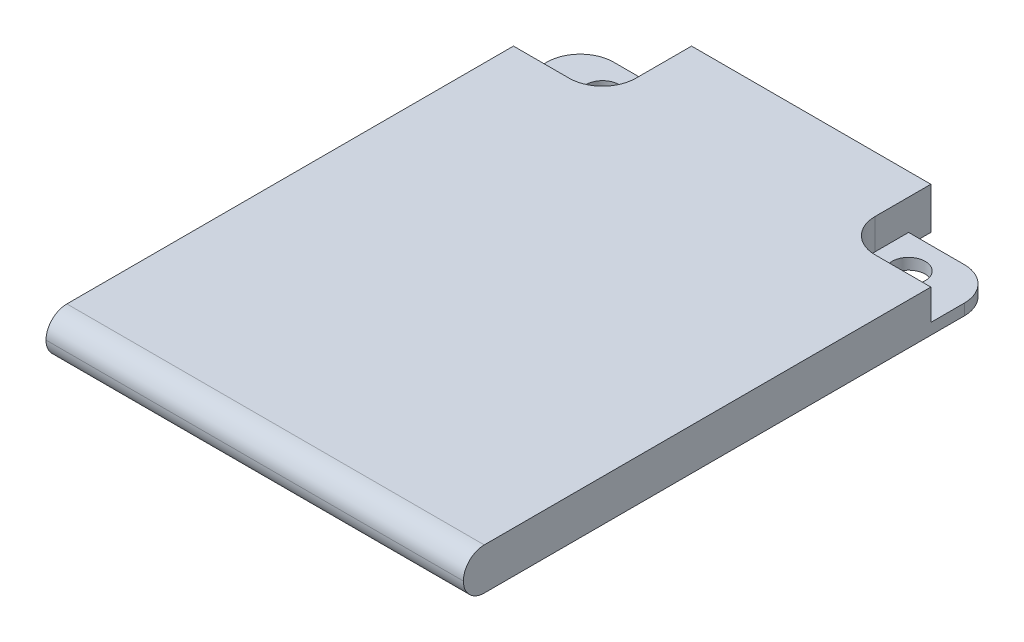
from build123d import *

# Parameters (mm, degrees)
SKETCH1_R           = 1.5
BOSS_EXTRUDE1_DEPTH = 3.75
FILLET1_R           = 1.875
CUT_EXTRUDE1_DEPTH  = 2.75
FILLET2_R           = 3


with BuildPart() as part:
    # Sketch1 → Boss-Extrude1 (new body)
    with BuildSketch(Plane(origin=(0, 0, 0), x_dir=(1, 0, 0), z_dir=(0, 1, 0))):
        Polygon((0, 0), (37.5, 0), (37.5, 48), (29.5, 48), (29.5, 50), (8, 50), (8, 48), (0, 48), align=None)
        with Locations(Location((5, 45, 0), (0, 0, 270))):
            Circle(SKETCH1_R, mode=Mode.SUBTRACT)
        with Locations(Location((32.5, 45, 0), (0, 0, 270))):
            Circle(SKETCH1_R, mode=Mode.SUBTRACT)
    extrude(amount=BOSS_EXTRUDE1_DEPTH)

    # Fillet1
    fillet1_edges = [part.edges().sort_by_distance(p)[0] for p in [
        (18.75, 0, 0),
        (18.75, 3.75, 0),
    ]]
    fillet(fillet1_edges, radius=FILLET1_R - 0.0001)  # a hair under: the kernel refuses the full size

    # Sketch2 → Cut-Extrude1 (cut)
    with BuildSketch(Plane(origin=(0, 3.75, 0), x_dir=(1, 0, 0), z_dir=(0, 1, 0))):
        with BuildLine():
            Line((8, 48), (0, 48))
            Line((0, 48), (0, 42))
            Line((0, 42), (5, 42))
            ThreePointArc((5, 42), (7.121320344, 42.878679656), (8, 45))
            Line((8, 45), (8, 48))
        make_face()
        with BuildLine():
            Line((29.5, 48), (37.5, 48))
            Line((37.5, 48), (37.5, 42))
            Line((37.5, 42), (32.5, 42))
            ThreePointArc((32.5, 42), (30.378679656, 42.878679656), (29.5, 45))
            Line((29.5, 45), (29.5, 48))
        make_face()
    extrude(amount=-CUT_EXTRUDE1_DEPTH, mode=Mode.SUBTRACT)

    # Fillet2
    fillet2_edges = [part.edges().sort_by_distance(p)[0] for p in [
        (0, 0.5, -48),
        (37.5, 0.5, -48),
    ]]
    fillet(fillet2_edges, radius=FILLET2_R)


solid = part.part
